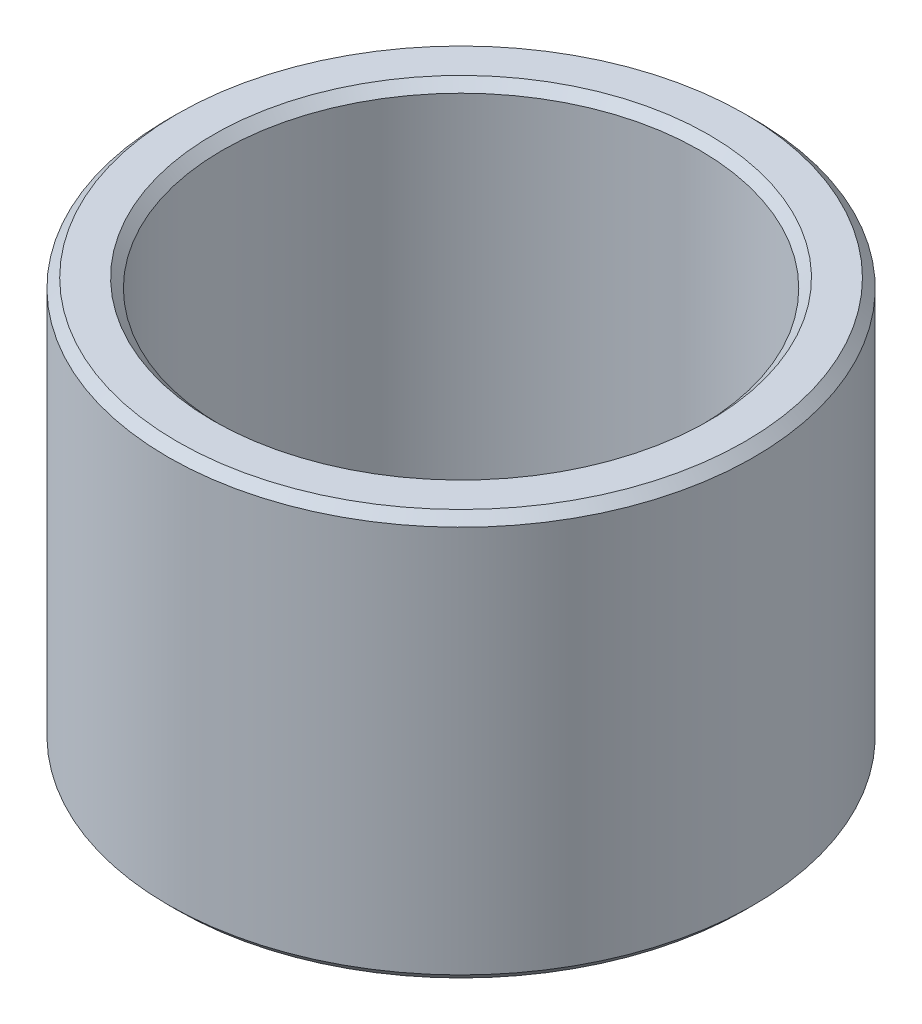
from build123d import *

# Parameters (mm, degrees)
SKETCH1_R           = 40
BOSS_EXTRUDE1_DEPTH = 55.419400848
SKETCH2_R           = 32.616553909
CUT_EXTRUDE1_DEPTH  = 80.191603029
CHAMFER1_SIZE       = 1.231694647


with BuildPart() as part:
    # Sketch1 → Boss-Extrude1 (new body)
    with BuildSketch(Plane(origin=(0, 0, 0), x_dir=(1, 0, 0), z_dir=(0, 1, 0))):
        Circle(SKETCH1_R)
    extrude(amount=BOSS_EXTRUDE1_DEPTH)

    # Sketch2 → Cut-Extrude1 (cut, through all)
    with BuildSketch(Plane(origin=(0, 0, 0), x_dir=(1, 0, 0), z_dir=(0, 1, 0))):
        Circle(SKETCH2_R)
    extrude(amount=CUT_EXTRUDE1_DEPTH, mode=Mode.SUBTRACT)

    # Chamfer1
    chamfer1_edges = [part.edges().sort_by_distance(p)[0] for p in [
        (-32.616553909, 55.419400848, 0),
        (-32.616553909, 0, 0),
        (-40, 0, 0),
        (-40, 55.419400848, 0),
    ]]
    chamfer(chamfer1_edges, length=CHAMFER1_SIZE)


solid = part.part
